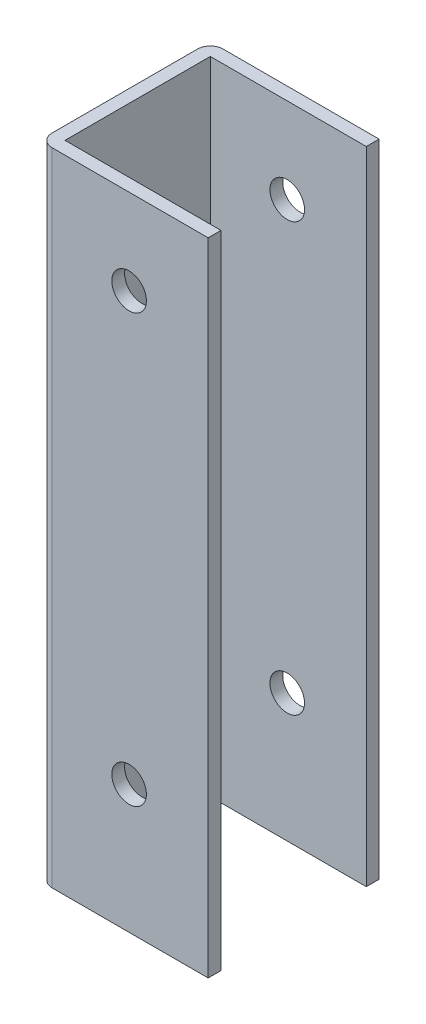
from build123d import *

# Parameters (mm, degrees)
SKETCH_1_W          = 74
SKETCH_1_H          = 34
EXTRUDE_1_DEPTH     = 150
SKETCH_2_W          = 41.646480438
SKETCH_2_H          = 42.526894273
CUT_EXTRUDE_1_DEPTH = 157.524758425
SKETCH_3_R          = 4.05
CUT_EXTRUDE_2_DEPTH = 161.312195419


with BuildPart() as part:
    # Эскиз1 → Вытянуть-Тонкостенный1 (new body)
    with BuildSketch(Plane(origin=(0, 0, 0), x_dir=(1, 0, 0), z_dir=(0, 1, 0))):
        with BuildLine():
            Line((40, 17), (40, -17))
            ThreePointArc((40, -17), (39.121320344, -19.121320344), (37, -20))
            Line((37, -20), (-37, -20))
            ThreePointArc((-37, -20), (-39.121320344, -19.121320344), (-40, -17))
            Line((-40, -17), (-40, 17))
            ThreePointArc((-40, 17), (-39.121320344, 19.121320344), (-37, 20))
            Line((-37, 20), (37, 20))
            ThreePointArc((37, 20), (39.121320344, 19.121320344), (40, 17))
        make_face()
        Rectangle(SKETCH_1_W, SKETCH_1_H, mode=Mode.SUBTRACT)
    extrude(amount=EXTRUDE_1_DEPTH)

    # Эскиз2 → Вырез-Вытянуть1 (cut, through all)
    with BuildSketch(Plane(origin=(0, 150, 0), x_dir=(1, 0, 0), z_dir=(0, 1, 0))):
        with Locations((20.323240219, -0.290673418)):
            Rectangle(SKETCH_2_W, SKETCH_2_H)
    extrude(amount=-CUT_EXTRUDE_1_DEPTH, mode=Mode.SUBTRACT)

    # Эскиз3 → Вырез-Вытянуть2 (cut, through all)
    with BuildSketch(Plane(origin=(0, 0, -20), x_dir=(-1, 0, 0), z_dir=(0, 0, -1))):
        with Locations((19, 130)):
            Circle(SKETCH_3_R)
        with Locations((19, 30)):
            Circle(SKETCH_3_R)
    extrude(amount=-CUT_EXTRUDE_2_DEPTH, mode=Mode.SUBTRACT)


solid = part.part
